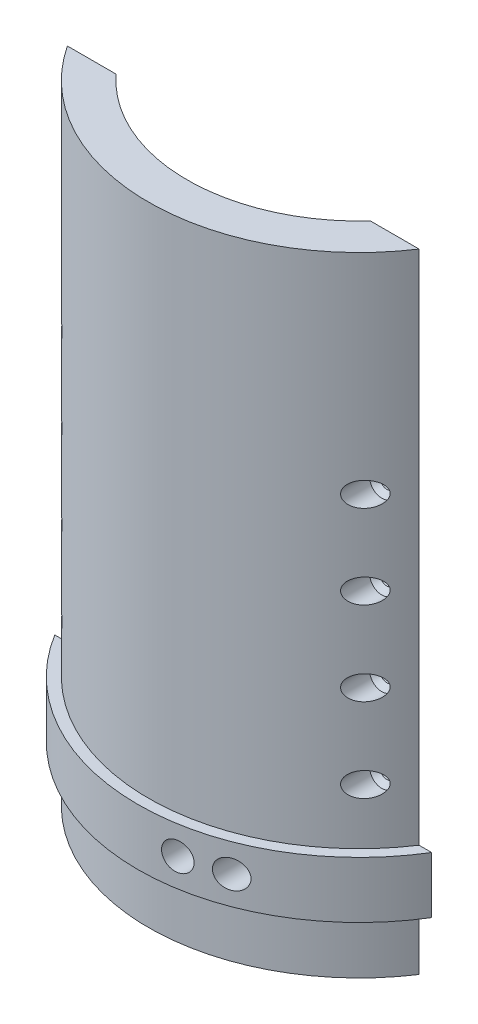
from build123d import *

# Parameters (mm, degrees)
BOSS_EXTRUDE1_DEPTH      = 120
LPATTERN1_COUNT          = 5
LPATTERN1_PITCH          = 20
BOSS_EXTRUDE2_DEPTH      = 6.731
BOSS_EXTRUDE2_DEPTH_BACK = 6.731
SKETCH9_R                = 3.334469726
CUT_EXTRUDE1_DEPTH       = 34
BOSS_EXTRUDE3_DEPTH      = 30


with BuildPart() as part:
    # Sketch1 → Boss-Extrude1 (new body)
    with BuildSketch(Plane(origin=(60.535204745, 0, -85.948449604), x_dir=(1, 0, 0), z_dir=(0, 1, 0))):
        with BuildLine():
            ThreePointArc((-30.186446753, -113.644462538), (-60.535204745, -127.035141416), (-90.883962736, -113.644462538))
            Line((-90.883962736, -113.644462538), (-102.513962844, -113.644462538))
            ThreePointArc((-102.513962844, -113.644462538), (-60.535204745, -136.240449604), (-18.556446645, -113.644462538))
            Line((-18.556446645, -113.644462538), (-30.186446753, -113.644462538))
        make_face()
    extrude(amount=BOSS_EXTRUDE1_DEPTH)

    # Sketch6 → Cut-Revolve4 (revolve, cut)
    with BuildSketch(Plane(origin=(36.163758045, 20, 27.696012934), x_dir=(-1, 0, 0), z_dir=(0, -1, 0))):
        Polygon((0, 1.685394277), (0, -4.78184701), (0, -15.185924704), (-2.9, -15.185924704), (-2.9, -3.079025683), (-1.65, -1.881964943), (-1.65, 1.685394277), align=None)
    cut_revolve4 = revolve(axis=Axis((36.163758045, 20, 26.010618657), (0, 0, 1)), mode=Mode.SUBTRACT)

    # LPattern1: Cut-Revolve4 ×5
    with Locations(*[(0, i * LPATTERN1_PITCH, 0) for i in range(1, LPATTERN1_COUNT)]):
        add(cut_revolve4, mode=Mode.SUBTRACT)

    # Mirror1: Cut-Revolve4 across plane
    add(cut_revolve4.mirror(Plane(origin=(0, 0, 0), x_dir=(0, 0, 1), z_dir=(1, 0, 0))), mode=Mode.SUBTRACT)

    # Mirror1 copy 1 sketch → Mirror1 copy 1 (revolve, cut)
    with BuildSketch(Plane(origin=(-36.163758045, 40, 27.696012934), x_dir=(1, 0, 0), z_dir=(0, -1, 0))):
        Polygon((0, -1.685394277), (0, 4.78184701), (0, 15.185924704), (-2.9, 15.185924704), (-2.9, 3.079025683), (-1.65, 1.881964943), (-1.65, -1.685394277), align=None)
    revolve(axis=Axis((-36.163758045, 40, 26.010618657), (0, 0, -1)), mode=Mode.SUBTRACT)

    # Mirror1 copy 2 sketch → Mirror1 copy 2 (revolve, cut)
    with BuildSketch(Plane(origin=(-36.163758045, 60, 27.696012934), x_dir=(1, 0, 0), z_dir=(0, -1, 0))):
        Polygon((0, -1.685394277), (0, 4.78184701), (0, 15.185924704), (-2.9, 15.185924704), (-2.9, 3.079025683), (-1.65, 1.881964943), (-1.65, -1.685394277), align=None)
    revolve(axis=Axis((-36.163758045, 60, 26.010618657), (0, 0, -1)), mode=Mode.SUBTRACT)

    # Mirror1 copy 3 sketch → Mirror1 copy 3 (revolve, cut)
    with BuildSketch(Plane(origin=(-36.163758045, 80, 27.696012934), x_dir=(1, 0, 0), z_dir=(0, -1, 0))):
        Polygon((0, -1.685394277), (0, 4.78184701), (0, 15.185924704), (-2.9, 15.185924704), (-2.9, 3.079025683), (-1.65, 1.881964943), (-1.65, -1.685394277), align=None)
    revolve(axis=Axis((-36.163758045, 80, 26.010618657), (0, 0, -1)), mode=Mode.SUBTRACT)

    # Mirror1 copy 4 sketch → Mirror1 copy 4 (revolve, cut)
    with BuildSketch(Plane(origin=(-36.163758045, 100, 27.696012934), x_dir=(1, 0, 0), z_dir=(0, -1, 0))):
        Polygon((0, -1.685394277), (0, 4.78184701), (0, 15.185924704), (-2.9, 15.185924704), (-2.9, 3.079025683), (-1.65, 1.881964943), (-1.65, -1.685394277), align=None)
    revolve(axis=Axis((-36.163758045, 100, 26.010618657), (0, 0, -1)), mode=Mode.SUBTRACT)

    # Sketch7 → Boss-Extrude2 (add, two sides: drawn at the far end of the back side and taken through both)
    with BuildSketch(Plane(origin=(0, 20, 0), x_dir=(-1, 0, 0), z_dir=(0, -1, 0)).offset(-BOSS_EXTRUDE2_DEPTH_BACK)):
        with BuildLine():
            Line((-44.990566695, -27.696012934), (-41.978758099, -27.696012934))
            ThreePointArc((-41.978758099, -27.696012934), (0, -50.292), (41.978758099, -27.696012934))
            Line((41.978758099, -27.696012934), (44.990566695, -27.696012934))
            ThreePointArc((44.990566695, -27.696012934), (0, -52.832), (-44.990566695, -27.696012934))
        make_face()
    extrude(amount=BOSS_EXTRUDE2_DEPTH + BOSS_EXTRUDE2_DEPTH_BACK)

    # Sketch9 → Cut-Extrude1 (cut)
    with BuildSketch(Plane(origin=(0, 0, 27.696012934), x_dir=(-1, 0, 0), z_dir=(0, 0, -1))):
        with Locations((-18.801989508, 20)):
            Circle(SKETCH9_R)
        with Locations((-8.69556827, 20)):
            Circle(SKETCH9_R)
    extrude(amount=-CUT_EXTRUDE1_DEPTH, mode=Mode.SUBTRACT)

    # Sketch10 → Boss-Extrude3 (add)
    with BuildSketch(Plane(origin=(0, 120, 0), x_dir=(1, 0, 0), z_dir=(0, 1, 0))):
        with BuildLine():
            Line((-30.348757991, -27.696012934), (-41.978758099, -27.696012934))
            ThreePointArc((-41.978758099, -27.696012934), (0, -50.292), (41.978758099, -27.696012934))
            Line((41.978758099, -27.696012934), (30.348757991, -27.696012934))
            ThreePointArc((30.348757991, -27.696012934), (0, -41.086691812), (-30.348757991, -27.696012934))
        make_face()
    extrude(amount=BOSS_EXTRUDE3_DEPTH)


solid = part.part
